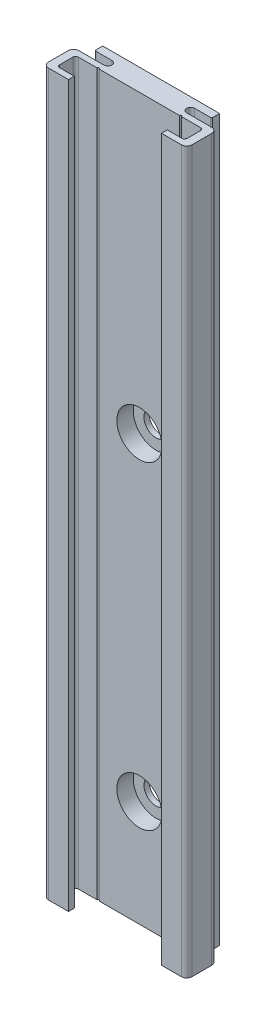
from build123d import *

# Parameters (mm, degrees)
BOSS_EXTRU_1_DEPTH                                 = 1000
ENL_V_MAT_EXTRU_1_DEPTH                            = 1001.128961684
CHAMBRAGE_POUR_VIS_T_TE_HEXAGONALE_M41_D           = 4.5
CHAMBRAGE_POUR_VIS_T_TE_HEXAGONALE_M41_CBORE_D     = 8.5
CHAMBRAGE_POUR_VIS_T_TE_HEXAGONALE_M41_CBORE_DEPTH = 3.1
DIAM_TRE_DU_PER_AGE_0_4_0_4_1_D                    = 0.4
CONG_1_R                                           = 0.2
CONG_2_R                                           = 0.5
CONG_3_R                                           = 1
ENL_V_MAT_EXTRU_2_DEPTH                            = 1001.128961684
ENL_V_MAT_EXTRU_2_DEPTH_BACK                       = 1001.128961684
ESQUISSE9_W                                        = 27
ESQUISSE9_H                                        = 864.38


with BuildPart() as part:
    # Esquisse1 → Boss.-Extru.1 (new body)
    with BuildSketch(Plane.XZ):
        with BuildLine():
            Line((13.5, 8.7), (-13.5, 8.7))
            Line((-13.5, 8.7), (-13.5, 3))
            Line((-13.5, 3), (-7.8, 3))
            ThreePointArc((-7.8, 3), (-7.05, 2.25), (-7.8, 1.5))
            Line((-7.8, 1.5), (-11, 1.5))
            Line((-11, 1.5), (-11, 0))
            Line((-11, 0), (11, 0))
            Line((11, 0), (11, 1.5))
            Line((11, 1.5), (7.8, 1.5))
            ThreePointArc((7.8, 1.5), (7.05, 2.25), (7.8, 3))
            Line((7.8, 3), (13.5, 3))
            Line((13.5, 3), (13.5, 8.7))
        make_face()
    extrude(amount=-BOSS_EXTRU_1_DEPTH)

    # Esquisse2 → Enlèv. mat.-Extru.1 (cut, through all)
    with BuildSketch(Plane(origin=(0, 1000, 0), x_dir=(-1, 0, 0), z_dir=(0, 1, 0))):
        Polygon((8.75, 8.7), (-8.75, 8.7), (-8.75, 7.6), (-12, 7.6), (-12, 4.1), (12, 4.1), (12, 7.6), (8.75, 7.6), align=None)
    extrude(amount=-ENL_V_MAT_EXTRU_1_DEPTH, mode=Mode.SUBTRACT)

    # Chambrage pour vis à tête hexagonale M41 (through all)
    with Locations(Plane.XY.offset(4.1)):
        with Locations((0, 980), (0, 920), (0, 860), (0, 800), (0, 740), (0, 680), (0, 620), (0, 560), (0, 500), (0, 440), (0, 380), (0, 320), (0, 260), (0, 200), (0, 140), (0, 80), (0, 20)):
            CounterBoreHole(CHAMBRAGE_POUR_VIS_T_TE_HEXAGONALE_M41_D / 2, CHAMBRAGE_POUR_VIS_T_TE_HEXAGONALE_M41_CBORE_D / 2, CHAMBRAGE_POUR_VIS_T_TE_HEXAGONALE_M41_CBORE_DEPTH)

    # Diamètre du perçage Ø0.4 (0.4)1 (through all)
    with Locations(Plane(origin=(0, 0, 0), x_dir=(-1, 0, 0), z_dir=(0, -1, 0))):
        with Locations((7.75, -4.1), (-7.75, -4.1)):
            Hole(DIAM_TRE_DU_PER_AGE_0_4_0_4_1_D / 2)

    # Congé1
    cong_1_edges = [part.edges().sort_by_distance(p)[0] for p in [
        (11, 500, 1.5),
        (-11, 500, 1.5),
    ]]
    fillet(cong_1_edges, radius=CONG_1_R)

    # Congé2
    cong_2_edges = [part.edges().sort_by_distance(p)[0] for p in [
        (12, 500, 7.6),
        (12, 500, 4.1),
        (-12, 500, 7.6),
        (-12, 500, 4.1),
    ]]
    fillet(cong_2_edges, radius=CONG_2_R)

    # Congé3
    cong_3_edges = [part.edges().sort_by_distance(p)[0] for p in [
        (13.5, 500, 3),
        (13.5, 500, 8.7),
        (-13.5, 500, 3),
        (-13.5, 500, 8.7),
    ]]
    fillet(cong_3_edges, radius=CONG_3_R)

    # Esquisse9 → Enlèv. mat.-Extru.2 (cut, two sides: drawn at the far end of the back side and taken through both)
    with BuildSketch(Plane.XY.offset(-ENL_V_MAT_EXTRU_2_DEPTH_BACK)):
        with Locations((0, 567.81)):
            Rectangle(ESQUISSE9_W, ESQUISSE9_H)
    extrude(amount=ENL_V_MAT_EXTRU_2_DEPTH + ENL_V_MAT_EXTRU_2_DEPTH_BACK, mode=Mode.SUBTRACT)


solid = part.part
